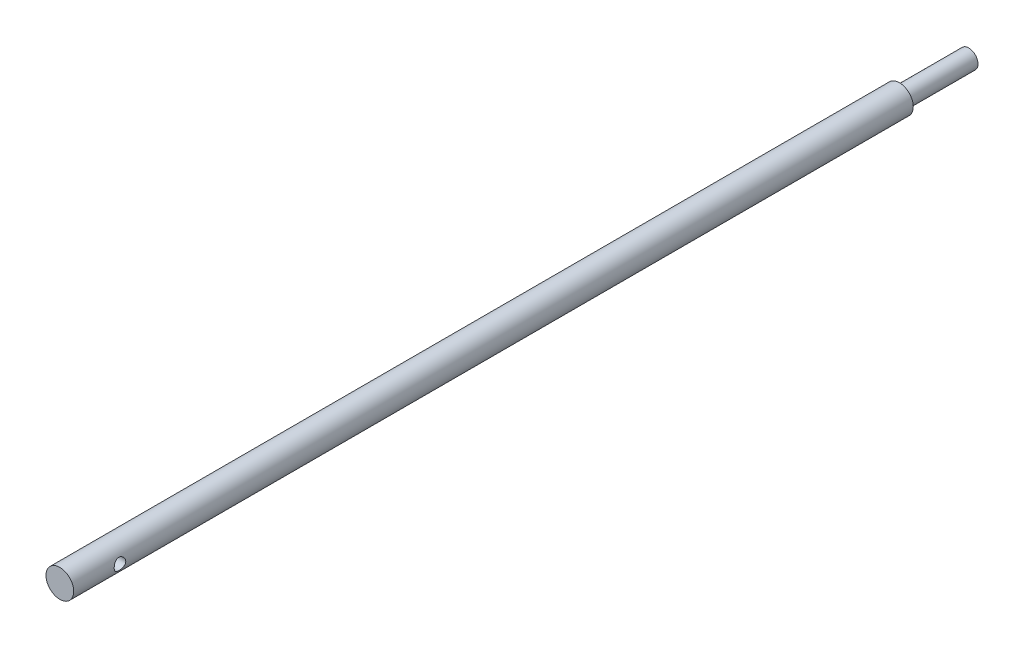
from build123d import *

# Parameters (mm, degrees)
SKETCH2_R               = 3
BOSS_EXTRUDE1_DEPTH     = 181.5
SKETCH6_R               = 2
BOSS_EXTRUDE3_DEPTH     = 15
CUT_EXTRUDE1_DEPTH      = 197.54579619
CUT_EXTRUDE1_DEPTH_BACK = 197.54579619
SKETCH9_R               = 1.25


with BuildPart() as part:
    # Sketch2 → Boss-Extrude1 (new body)
    with BuildSketch(Plane.XY):
        Circle(SKETCH2_R)
    extrude(amount=-BOSS_EXTRUDE1_DEPTH)

    # Sketch6 → Boss-Extrude3 (add)
    with BuildSketch(Plane(origin=(0, 0, -181.5), x_dir=(-1, 0, 0), z_dir=(0, 0, -1))):
        Circle(SKETCH6_R)
    extrude(amount=BOSS_EXTRUDE3_DEPTH)

    # Sketch9 → Cut-Extrude1 (cut, two sides: drawn at the far end of the back side and taken through both)
    with BuildSketch(Plane(origin=(0, 0, 0), x_dir=(0, 0, -1), z_dir=(1, 0, 0)).offset(-CUT_EXTRUDE1_DEPTH_BACK)):
        with Locations((10, 0)):
            Circle(SKETCH9_R)
    extrude(amount=CUT_EXTRUDE1_DEPTH + CUT_EXTRUDE1_DEPTH_BACK, mode=Mode.SUBTRACT)


solid = part.part
